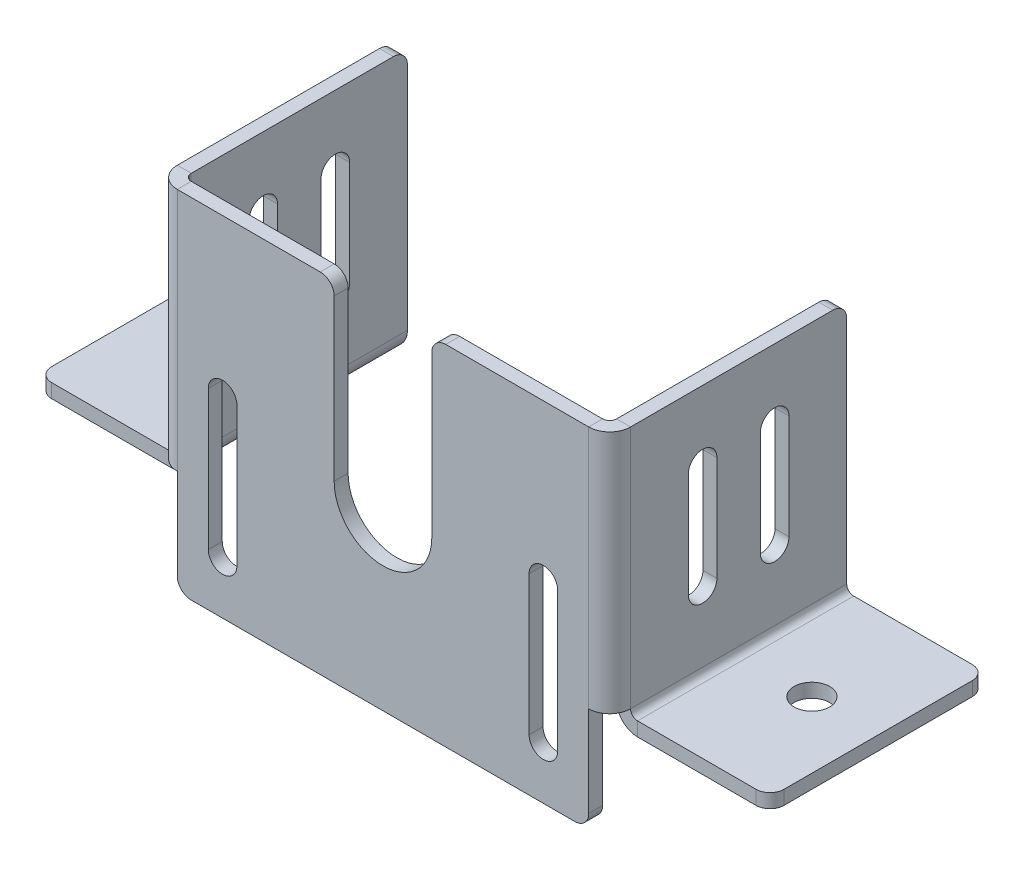
from build123d import *

# Parameters (mm, degrees)
SKETCH1_W               = 59
SKETCH1_H               = 50
BASE_FLANGE1_DEPTH      = 2
EDGE_FLANGE1_DEPTH      = 35
EDGE_FLANGE1_BEND_DEPTH = 35
EDGE_FLANGE2_DEPTH      = 31
EDGE_FLANGE2_BEND_DEPTH = 31
CUT_EXTRUDE1_REACH      = 69.359
CUT_EXTRUDE2_REACH      = 74.168
SKETCH19_R              = 2.55
CUT_EXTRUDE3_REACH      = 69.359
SKETCH20_R              = 7
BREAK_CORNER1_START     = -13
BREAK_CORNER1_DEPTH     = 2
BREAK_CORNER1_START_2   = -32.5
BREAK_CORNER1_2_DEPTH   = 65
BREAK_CORNER1_START_3   = -2
BREAK_CORNER1_3_DEPTH   = 2
CUT_EXTRUDE4_DEPTH      = 95.899947313


# Read off the part's stored shape, not the designer's step: Break-Corner1
# Sheet-metal steps are written as plain solids
with BuildPart() as part:
    # Sketch1 → Base-Flange1 (new body)
    with BuildSketch(Plane.XY):
        Rectangle(SKETCH1_W, SKETCH1_H)
    extrude(amount=-BASE_FLANGE1_DEPTH)

    # Edge-Flange1 section (across the edge) → Edge-Flange1 (add)
    with BuildSketch(Plane(origin=(30.5, 25, -2), x_dir=(-1, 0, 0), z_dir=(0, -1, 0))):
        with BuildLine():
            Line((-2, 1), (-2, 32))
            Line((-2, 32), (0, 32))
            Line((0, 32), (0, 1))
            ThreePointArc((0, 1), (0.292893219, 0.292893219), (1, 0))
            Line((1, 0), (1, -2))
            ThreePointArc((1, -2), (-1.121320344, -1.121320344), (-2, 1))
        make_face()
    extrude(amount=EDGE_FLANGE1_DEPTH)

    # Edge-Flange1 section 2 (across the edge) → Edge-Flange1 bend (add)
    with BuildSketch(Plane(origin=(-30.5, -10, -2), x_dir=(1, 0, 0), z_dir=(0, 1, 0))):
        with BuildLine():
            Line((-2, 1), (-2, 32))
            Line((-2, 32), (0, 32))
            Line((0, 32), (0, 1))
            ThreePointArc((0, 1), (0.292893219, 0.292893219), (1, 0))
            Line((1, 0), (1, -2))
            ThreePointArc((1, -2), (-1.121320344, -1.121320344), (-2, 1))
        make_face()
    extrude(amount=EDGE_FLANGE1_BEND_DEPTH)

    # Edge-Flange2 section (across the edge) → Edge-Flange2 (add)
    with BuildSketch(Plane(origin=(32.5, -11, -3), x_dir=(0, 1, 0), z_dir=(0, 0, -1))):
        with BuildLine():
            Line((-2, 1), (-2, 20))
            Line((-2, 20), (0, 20))
            Line((0, 20), (0, 1))
            ThreePointArc((0, 1), (0.292893219, 0.292893219), (1, 0))
            Line((1, 0), (1, -2))
            ThreePointArc((1, -2), (-1.121320344, -1.121320344), (-2, 1))
        make_face()
    extrude(amount=EDGE_FLANGE2_DEPTH)

    # Edge-Flange2 section 2 (across the edge) → Edge-Flange2 bend (add)
    with BuildSketch(Plane(origin=(-32.5, -11, -34), x_dir=(0, 1, 0), z_dir=(0, 0, 1))):
        with BuildLine():
            Line((-2, 1), (-2, 20))
            Line((-2, 20), (0, 20))
            Line((0, 20), (0, 1))
            ThreePointArc((0, 1), (0.292893219, 0.292893219), (1, 0))
            Line((1, 0), (1, -2))
            ThreePointArc((1, -2), (-1.121320344, -1.121320344), (-2, 1))
        make_face()
    extrude(amount=EDGE_FLANGE2_BEND_DEPTH)

    # Sketch18 → Cut-Extrude1 (cut, up to next)
    with BuildSketch(Plane.XY, mode=Mode.PRIVATE) as cut_extrude1_sk1:
        with BuildLine():
            Line((-20.95, 2.5), (-20.95, -17.5))
            ThreePointArc((-20.95, -17.5), (-23, -19.55), (-25.05, -17.5))
            Line((-25.05, -17.5), (-25.05, 2.5))
            ThreePointArc((-25.05, 2.5), (-23, 4.55), (-20.95, 2.5))
        make_face()
    cut_extrude1_tool1 = extrude(cut_extrude1_sk1.sketch, amount=-CUT_EXTRUDE1_REACH, mode=Mode.PRIVATE) & part.part
    # Sketch18 → Cut-Extrude1 (cut, up to next)
    with BuildSketch(Plane.XY, mode=Mode.PRIVATE) as cut_extrude1_sk2:
        with BuildLine():
            Line((20.95, -17.5), (20.95, 2.5))
            ThreePointArc((20.95, 2.5), (23, 4.55), (25.05, 2.5))
            Line((25.05, 2.5), (25.05, -17.5))
            ThreePointArc((25.05, -17.5), (23, -19.55), (20.95, -17.5))
        make_face()
    cut_extrude1_tool2 = extrude(cut_extrude1_sk2.sketch, amount=-CUT_EXTRUDE1_REACH, mode=Mode.PRIVATE) & part.part
    add(cut_extrude1_tool1.solids().sort_by_distance((-23, -7.5, 0))[0], mode=Mode.SUBTRACT)
    add(cut_extrude1_tool2.solids().sort_by_distance((23, -7.5, 0))[0], mode=Mode.SUBTRACT)

    # Sketch19 → Cut-Extrude2 (cut, up to next)
    with BuildSketch(Plane(origin=(0, -11, 0), x_dir=(1, 0, 0), z_dir=(0, 1, 0)), mode=Mode.PRIVATE) as cut_extrude2_sk1:
        with Locations(Location((43, 18.5, 0), (0, 0, 180))):
            Circle(SKETCH19_R)
    cut_extrude2_tool1 = extrude(cut_extrude2_sk1.sketch, amount=-CUT_EXTRUDE2_REACH, mode=Mode.PRIVATE) & part.part
    # Sketch19 → Cut-Extrude2 (cut, up to next)
    with BuildSketch(Plane(origin=(0, -11, 0), x_dir=(1, 0, 0), z_dir=(0, 1, 0)), mode=Mode.PRIVATE) as cut_extrude2_sk2:
        with Locations(Location((-43, 18.5, 0), (0, 0, 180))):
            Circle(SKETCH19_R)
    cut_extrude2_tool2 = extrude(cut_extrude2_sk2.sketch, amount=-CUT_EXTRUDE2_REACH, mode=Mode.PRIVATE) & part.part
    add(cut_extrude2_tool1.solids().sort_by_distance((43, -11, -18.5))[0], mode=Mode.SUBTRACT)
    add(cut_extrude2_tool2.solids().sort_by_distance((-43, -11, -18.5))[0], mode=Mode.SUBTRACT)

    # Sketch20 → Cut-Extrude3 (cut, up to next)
    with BuildSketch(Plane.XY, mode=Mode.PRIVATE) as cut_extrude3_sk1:
        Circle(SKETCH20_R)
    cut_extrude3_tool1 = extrude(cut_extrude3_sk1.sketch, amount=-CUT_EXTRUDE3_REACH, mode=Mode.PRIVATE) & part.part
    # Sketch20 → Cut-Extrude3 (cut, up to next)
    with BuildSketch(Plane.XY, mode=Mode.PRIVATE) as cut_extrude3_sk2:
        with BuildLine():
            ThreePointArc((-7, 0), (0, 7), (7, 0))
            Line((7, 0), (7, 25))
            Line((7, 25), (-7, 25))
            Line((-7, 25), (-7, 0))
        make_face()
    cut_extrude3_tool2 = extrude(cut_extrude3_sk2.sketch, amount=-CUT_EXTRUDE3_REACH, mode=Mode.PRIVATE) & part.part
    add(cut_extrude3_tool1.solids().sort_by_distance((0, 0, 0))[0], mode=Mode.SUBTRACT)
    add(cut_extrude3_tool2.solids().sort_by_distance((0, 15.186311, 0))[0], mode=Mode.SUBTRACT)

    # Break-Corner1 outline → Break-Corner1 (cut)
    with BuildSketch(Plane(origin=(0, 0, 0), x_dir=(1, 0, 0), z_dir=(0, 1, 0)).offset(BREAK_CORNER1_START)):
        with BuildLine():
            ThreePointArc((50.5, 34), (51.914213562, 33.414213562), (52.5, 32))
            Line((52.5, 32), (52.5, 34))
            Line((52.5, 34), (50.5, 34))
        make_face()
        with BuildLine():
            ThreePointArc((52.5, 5), (51.914213562, 3.585786438), (50.5, 3))
            Line((50.5, 3), (52.5, 3))
            Line((52.5, 3), (52.5, 5))
        make_face()
        with BuildLine():
            ThreePointArc((-50.5, 3), (-51.914213562, 3.585786438), (-52.5, 5))
            Line((-52.5, 5), (-52.5, 3))
            Line((-52.5, 3), (-50.5, 3))
        make_face()
        with BuildLine():
            ThreePointArc((-52.5, 32), (-51.914213562, 33.414213562), (-50.5, 34))
            Line((-50.5, 34), (-52.5, 34))
            Line((-52.5, 34), (-52.5, 32))
        make_face()
    extrude(amount=BREAK_CORNER1_DEPTH, mode=Mode.SUBTRACT)

    # Break-Corner1 2 outline → Break-Corner1 2 (cut)
    with BuildSketch(Plane.YZ.offset(BREAK_CORNER1_START_2)):
        with BuildLine():
            Line((25, -34), (25, -32))
            ThreePointArc((25, -32), (24.414213562, -33.414213562), (23, -34))
            Line((23, -34), (25, -34))
        make_face()
    extrude(amount=BREAK_CORNER1_2_DEPTH, mode=Mode.SUBTRACT)

    # Break-Corner1 3 outline → Break-Corner1 3 (cut)
    with BuildSketch(Plane.XY.offset(BREAK_CORNER1_START_3)):
        with BuildLine():
            Line((7, 25), (7, 23))
            ThreePointArc((7, 23), (7.585786438, 24.414213562), (9, 25))
            Line((9, 25), (7, 25))
        make_face()
        with BuildLine():
            Line((-29.5, -25), (-27.5, -25))
            ThreePointArc((-27.5, -25), (-28.914213562, -24.414213562), (-29.5, -23))
            Line((-29.5, -23), (-29.5, -25))
        make_face()
        with BuildLine():
            ThreePointArc((29.5, -23), (28.914213562, -24.414213562), (27.5, -25))
            Line((27.5, -25), (29.5, -25))
            Line((29.5, -25), (29.5, -23))
        make_face()
        with BuildLine():
            ThreePointArc((-9, 25), (-7.585786438, 24.414213562), (-7, 23))
            Line((-7, 23), (-7, 25))
            Line((-7, 25), (-9, 25))
        make_face()
    extrude(amount=BREAK_CORNER1_3_DEPTH, mode=Mode.SUBTRACT)

    # Sketch21 → Cut-Extrude4 (cut, through all)
    with BuildSketch(Plane.ZY.offset(32.5)):
        with BuildLine():
            Line((-21.616666667, 15), (-21.616666667, 0))
            ThreePointArc((-21.616666667, 0), (-23.666666667, -2.05), (-25.716666667, 0))
            Line((-25.716666667, 0), (-25.716666667, 15))
            ThreePointArc((-25.716666667, 15), (-23.666666667, 17.05), (-21.616666667, 15))
        make_face()
        with BuildLine():
            Line((-11.283333333, 15), (-11.283333333, 0))
            ThreePointArc((-11.283333333, 0), (-13.333333333, -2.05), (-15.383333333, 0))
            Line((-15.383333333, 0), (-15.383333333, 15))
            ThreePointArc((-15.383333333, 15), (-13.333333333, 17.05), (-11.283333333, 15))
        make_face()
    extrude(amount=-CUT_EXTRUDE4_DEPTH, mode=Mode.SUBTRACT)


solid = part.part
